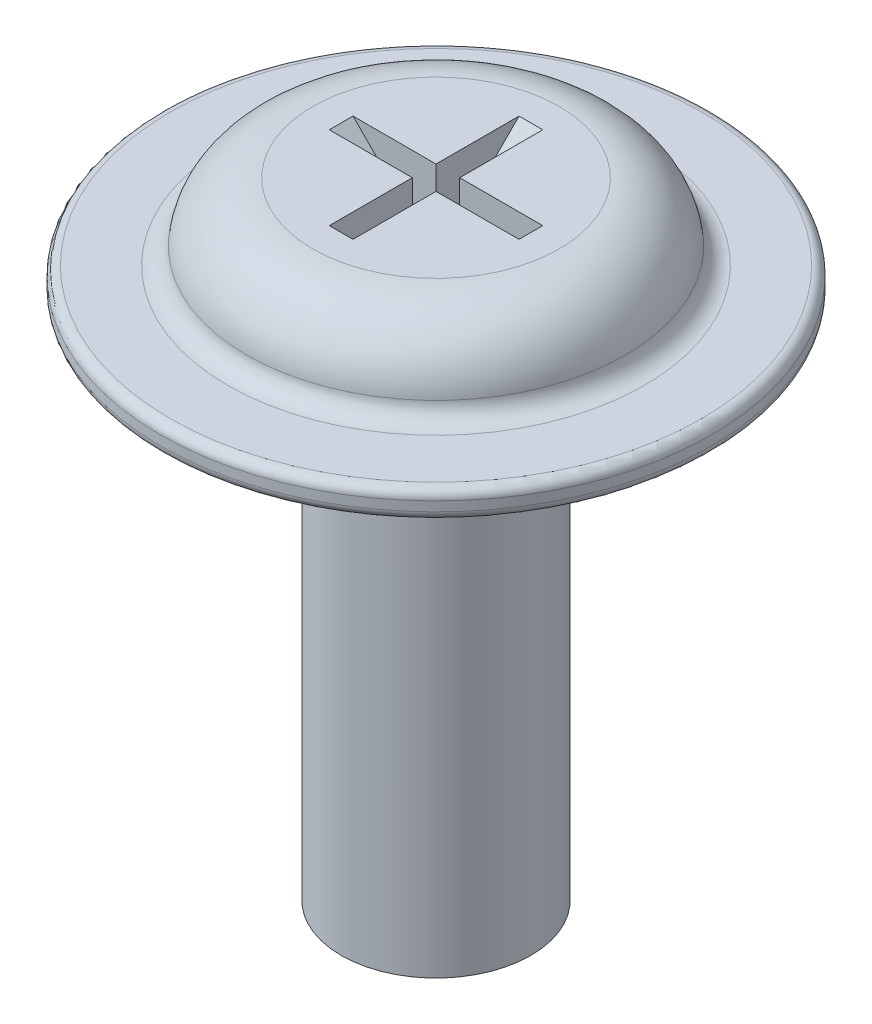
from build123d import *

# Parameters (mm, degrees)
SKETCH2_R           = 2.9
BOSS_EXTRUDE1_DEPTH = 0.3
FILLET1_R           = 0.1
SKETCH4_R           = 1
BOSS_EXTRUDE2_DEPTH = 5.5
CUT_EXTRUDE1_DEPTH  = 0.5
CHAMFER2_SIZE       = 0.5
FILLET2_R           = 0.2
FILLET3_R           = 0.1
FILLET4_R           = 0.1


with BuildPart() as part:
    # Sketch2 → Boss-Extrude1 (new body)
    with BuildSketch(Plane(origin=(0, 0, 0), x_dir=(1, 0, 0), z_dir=(0, 1, 0))):
        with Locations(Location((0, 0, 0), (0, 0, 270))):
            Circle(SKETCH2_R)
    extrude(amount=BOSS_EXTRUDE1_DEPTH)

    # Fillet1
    fillet1_edges = [part.edges().sort_by_distance(p)[0] for p in [
        (0, 0.3, -2.9),
    ]]
    fillet(fillet1_edges, radius=FILLET1_R)

    # Sketch3 → Revolve1 (revolve)
    with BuildSketch(Plane.XY, mode=Mode.PRIVATE) as revolve1_sk:
        with BuildLine():
            Line((2, 0.3), (0, 0.3))
            Line((0, 0.3), (0, 1.1))
            Line((0, 1.1), (1.3, 1.1))
            ThreePointArc((1.3, 1.1), (1.794974747, 0.894974747), (2, 0.4))
            Line((2, 0.4), (2, 0.3))
        make_face()
    revolve(revolve1_sk.sketch.rotate(Axis((0, 0, 0), (0, -1, 0)), 90), axis=Axis((0, 0, 0), (0, -1, 0)))

    # Sketch4 → Boss-Extrude2 (add)
    with BuildSketch(Plane.XZ):
        with Locations(Location((0, 0, 0), (0, 0, 270))):
            Circle(SKETCH4_R)
    extrude(amount=BOSS_EXTRUDE2_DEPTH)

    # Sketch5 → Cut-Extrude1 (cut)
    with BuildSketch(Plane(origin=(0, 1.1, 0), x_dir=(1, 0, 0), z_dir=(0, 1, 0))):
        Polygon((-0.125, 0.5), (0.125, 0.5), (0.125, 0.125), (0.5, 0.125), (0.5, -0.125), (0.125, -0.125), (0.125, -0.5), (-0.125, -0.5), (-0.125, -0.125), (-0.5, -0.125), (-0.5, 0.125), (-0.125, 0.125), align=None)
    extrude(amount=-CUT_EXTRUDE1_DEPTH, mode=Mode.SUBTRACT)

    # Chamfer2
    chamfer2_edges = [part.edges().sort_by_distance(p)[0] for p in [
        (-0.5, 1.1, 0),
        (0, 1.1, 0.5),
        (0.5, 1.1, 0),
        (0, 1.1, -0.5),
    ]]
    chamfer(chamfer2_edges, length=CHAMFER2_SIZE - 0.0001)  # a hair under: the kernel refuses the full size

    # Fillet2
    fillet2_edges = [part.edges().sort_by_distance(p)[0] for p in [
        (0, 0.3, -2),
    ]]
    fillet(fillet2_edges, radius=FILLET2_R)

    # Fillet3
    fillet3_edges = [part.edges().sort_by_distance(p)[0] for p in [
        (0, 0, -2.9),
    ]]
    fillet(fillet3_edges, radius=FILLET3_R)

    # Fillet4
    fillet4_edges = [part.edges().sort_by_distance(p)[0] for p in [
        (0, 0, 1),
    ]]
    fillet(fillet4_edges, radius=FILLET4_R)


solid = part.part
